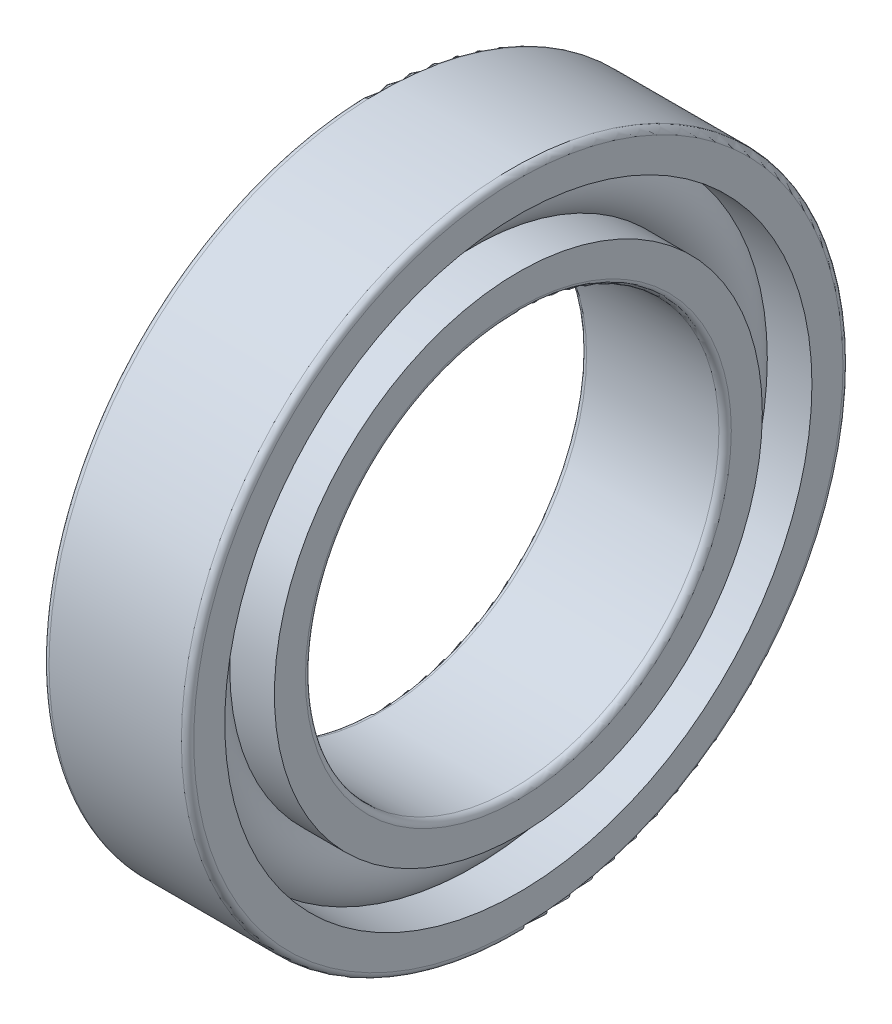
from build123d import *

# Parameters (mm, degrees)
CAGSPISKE_W     = 0.36
CAGSPISKE_H     = 0.6
CAGESPINE_ANGLE = 0.001
BALSIMSKE_R     = 1.8


with BuildPart() as part:
    # CagSpiSke → CageSpine (revolve)
    with BuildSketch(Plane.XY):
        with Locations((0, 13)):
            Rectangle(CAGSPISKE_W, CAGSPISKE_H)
    revolve(axis=Axis((-20.6375, 0, 0), (-1, 0, 0)), revolution_arc=CAGESPINE_ANGLE)

    # BalSimSke → BallsSimplified (revolve)
    with BuildSketch(Plane.XY):
        with Locations((0, 13)):
            Circle(BALSIMSKE_R)
    revolve(axis=Axis((-10, 0, 0), (1, 0, 0)))

    # InnRacSke → InnerRace (revolve)
    with BuildSketch(Plane.XY):
        with BuildLine():
            Line((-1.307908636, 11.8), (-3.5, 11.8))
            Line((-3.5, 11.8), (-3.5, 10.3))
            ThreePointArc((-3.5, 10.3), (-3.412132034, 10.087867966), (-3.2, 10))
            Line((-3.2, 10), (3.2, 10))
            ThreePointArc((3.2, 10), (3.412132034, 10.087867966), (3.5, 10.3))
            Line((3.5, 10.3), (3.5, 11.8))
            Line((3.5, 11.8), (1.307908636, 11.8))
            ThreePointArc((1.307908636, 11.8), (0, 11.225), (-1.307908636, 11.8))
        make_face()
    revolve(axis=Axis((-20.6375, 0, 0), (1, 0, 0)))

    # OutRacSke → OuterRace (revolve)
    with BuildSketch(Plane.XY):
        with BuildLine():
            Line((-1.307908636, 14.2), (-3.5, 14.2))
            Line((-3.5, 14.2), (-3.5, 15.7))
            ThreePointArc((-3.5, 15.7), (-3.412132034, 15.912132034), (-3.2, 16))
            Line((-3.2, 16), (3.2, 16))
            ThreePointArc((3.2, 16), (3.412132034, 15.912132034), (3.5, 15.7))
            Line((3.5, 15.7), (3.5, 14.2))
            Line((3.5, 14.2), (1.307908636, 14.2))
            ThreePointArc((1.307908636, 14.2), (0, 14.775), (-1.307908636, 14.2))
        make_face()
    revolve(axis=Axis((-20.6375, 0, 0), (1, 0, 0)))


solid = part.part
